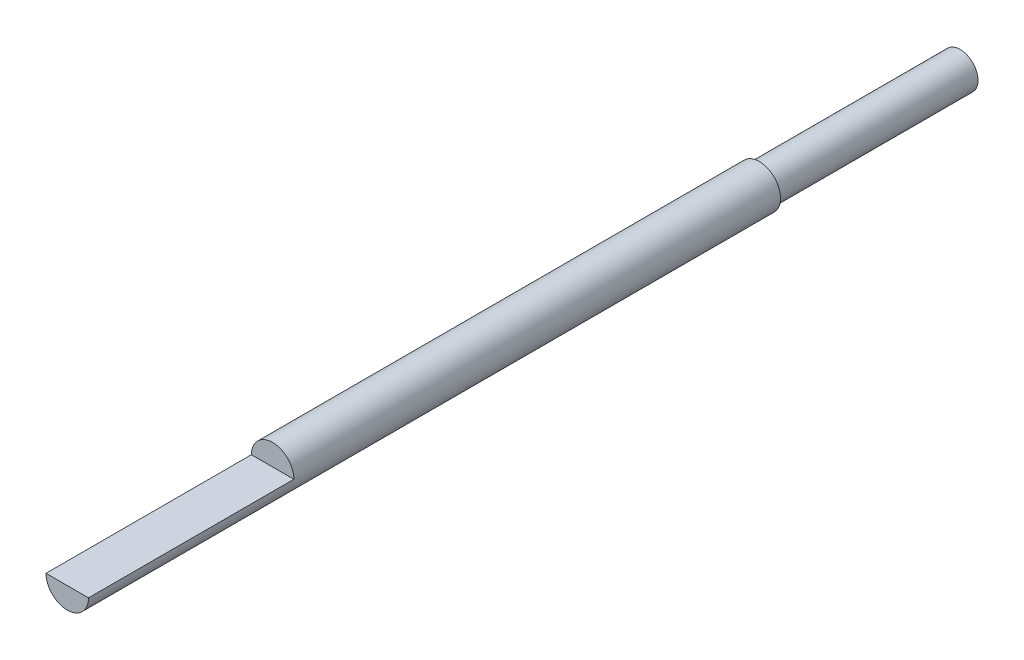
from build123d import *

# Parameters (mm, degrees)
SKETCH1_R           = 4.7625
BOSS_EXTRUDE1_DEPTH = 200
CUT_EXTRUDE1_START  = -46
CUT_EXTRUDE1_DEPTH  = 46
SKETCH3_R           = 4.7625
SKETCH3_R_2         = 4
CUT_EXTRUDE2_DEPTH  = 45


with BuildPart() as part:
    # Sketch1 → Boss-Extrude1 (new body)
    with BuildSketch(Plane.XY):
        Circle(SKETCH1_R)
    extrude(amount=BOSS_EXTRUDE1_DEPTH)

    # Sketch2 → Cut-Extrude1 (cut)
    with BuildSketch(Plane.XY.offset(200).offset(CUT_EXTRUDE1_START)):
        with BuildLine():
            ThreePointArc((4.7625, 0), (0, 4.7625), (-4.7625, 0))
            Line((-4.7625, 0), (4.7625, 0))
        make_face()
    extrude(amount=CUT_EXTRUDE1_DEPTH, mode=Mode.SUBTRACT)

    # Sketch3 → Cut-Extrude2 (cut)
    with BuildSketch(Plane(origin=(0, 0, 0), x_dir=(-1, 0, 0), z_dir=(0, 0, -1))):
        Circle(SKETCH3_R)
        Circle(SKETCH3_R_2, mode=Mode.SUBTRACT)
    extrude(amount=-CUT_EXTRUDE2_DEPTH, mode=Mode.SUBTRACT)


solid = part.part
